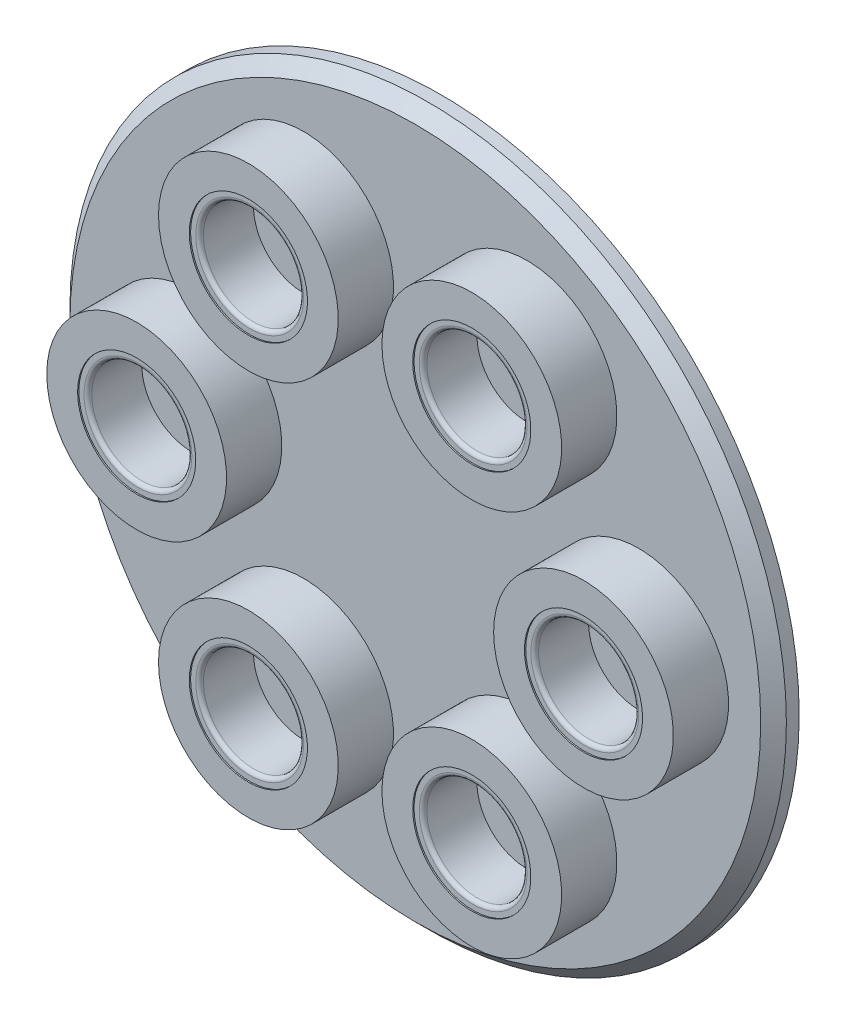
from build123d import *

# Parameters (mm, degrees)
SKETCH1_R           = 27.9
BOSS_EXTRUDE1_DEPTH = 2
CHAMFER1_SIZE       = 1
SKETCH2_R           = 7
SKETCH2_R_2         = 4.6
BOSS_EXTRUDE2_DEPTH = 4.3
SKETCH3_R           = 4.6
SKETCH3_R_2         = 3.9
BOSS_EXTRUDE4_DEPTH = 4.2
FILLET1_R           = 0.3


with BuildPart() as part:
    # Sketch1 → Boss-Extrude1 (new body)
    with BuildSketch(Plane.XY):
        Circle(SKETCH1_R)
    extrude(amount=BOSS_EXTRUDE1_DEPTH)

    # Chamfer1
    chamfer1_edges = [part.edges().sort_by_distance(p)[0] for p in [
        (-27.9, 0, 2),
    ]]
    chamfer(chamfer1_edges, length=CHAMFER1_SIZE)

    # Sketch2 → Boss-Extrude2 (add)
    # profile 1 of 6: a face of its own
    with BuildSketch(Plane.XY.offset(2)):
        with Locations((-8.7, 15.068842026)):
            Circle(SKETCH2_R)
        with Locations((-8.7, 15.068842026)):
            Circle(SKETCH2_R_2, mode=Mode.SUBTRACT)
    # profile 2 of 6: a face of its own
    with BuildSketch(Plane.XY.offset(2)):
        with Locations((8.7, 15.068842026)):
            Circle(SKETCH2_R)
        with Locations((8.7, 15.068842026)):
            Circle(SKETCH2_R_2, mode=Mode.SUBTRACT)
    # profile 3 of 6: a face of its own
    with BuildSketch(Plane.XY.offset(2)):
        with Locations((17.4, 0)):
            Circle(SKETCH2_R)
        with Locations((17.4, 0)):
            Circle(SKETCH2_R_2, mode=Mode.SUBTRACT)
    # profile 4 of 6: a face of its own
    with BuildSketch(Plane.XY.offset(2)):
        with Locations((8.7, -15.068842026)):
            Circle(SKETCH2_R)
        with Locations((8.7, -15.068842026)):
            Circle(SKETCH2_R_2, mode=Mode.SUBTRACT)
    # profile 5 of 6: a face of its own
    with BuildSketch(Plane.XY.offset(2)):
        with Locations((-8.7, -15.068842026)):
            Circle(SKETCH2_R)
        with Locations((-8.7, -15.068842026)):
            Circle(SKETCH2_R_2, mode=Mode.SUBTRACT)
    # profile 6 of 6: a face of its own
    with BuildSketch(Plane.XY.offset(2)):
        with Locations((-17.4, 0)):
            Circle(SKETCH2_R)
        with Locations((-17.4, 0)):
            Circle(SKETCH2_R_2, mode=Mode.SUBTRACT)
    extrude(amount=BOSS_EXTRUDE2_DEPTH)

    # Sketch3 → Boss-Extrude4 (add)
    # profile 1 of 6: a face of its own
    with BuildSketch(Plane.XY.offset(2)):
        with Locations((8.7, 15.068842026)):
            Circle(SKETCH3_R)
        with Locations((8.7, 15.068842026)):
            Circle(SKETCH3_R_2, mode=Mode.SUBTRACT)
    # profile 2 of 6: a face of its own
    with BuildSketch(Plane.XY.offset(2)):
        with Locations((-8.7, 15.068842026)):
            Circle(SKETCH3_R)
        with Locations((-8.7, 15.068842026)):
            Circle(SKETCH3_R_2, mode=Mode.SUBTRACT)
    # profile 3 of 6: a face of its own
    with BuildSketch(Plane.XY.offset(2)):
        with Locations((17.4, 0)):
            Circle(SKETCH3_R)
        with Locations((17.4, 0)):
            Circle(SKETCH3_R_2, mode=Mode.SUBTRACT)
    # profile 4 of 6: a face of its own
    with BuildSketch(Plane.XY.offset(2)):
        with Locations((8.7, -15.068842026)):
            Circle(SKETCH3_R)
        with Locations((8.7, -15.068842026)):
            Circle(SKETCH3_R_2, mode=Mode.SUBTRACT)
    # profile 5 of 6: a face of its own
    with BuildSketch(Plane.XY.offset(2)):
        with Locations((-8.7, -15.068842026)):
            Circle(SKETCH3_R)
        with Locations((-8.7, -15.068842026)):
            Circle(SKETCH3_R_2, mode=Mode.SUBTRACT)
    # profile 6 of 6: a face of its own
    with BuildSketch(Plane.XY.offset(2)):
        with Locations((-17.4, 0)):
            Circle(SKETCH3_R)
        with Locations((-17.4, 0)):
            Circle(SKETCH3_R_2, mode=Mode.SUBTRACT)
    extrude(amount=BOSS_EXTRUDE4_DEPTH)

    # Fillet1
    fillet1_edges = [part.edges().sort_by_distance(p)[0] for p in [
        (-21.3, 0, 6.2),
        (-12.6, -15.068842026, 6.2),
        (4.8, -15.068842026, 6.2),
        (13.5, 0, 6.2),
        (4.8, 15.068842026, 6.2),
        (-12.6, 15.068842026, 6.2),
    ]]
    fillet(fillet1_edges, radius=FILLET1_R)


solid = part.part
